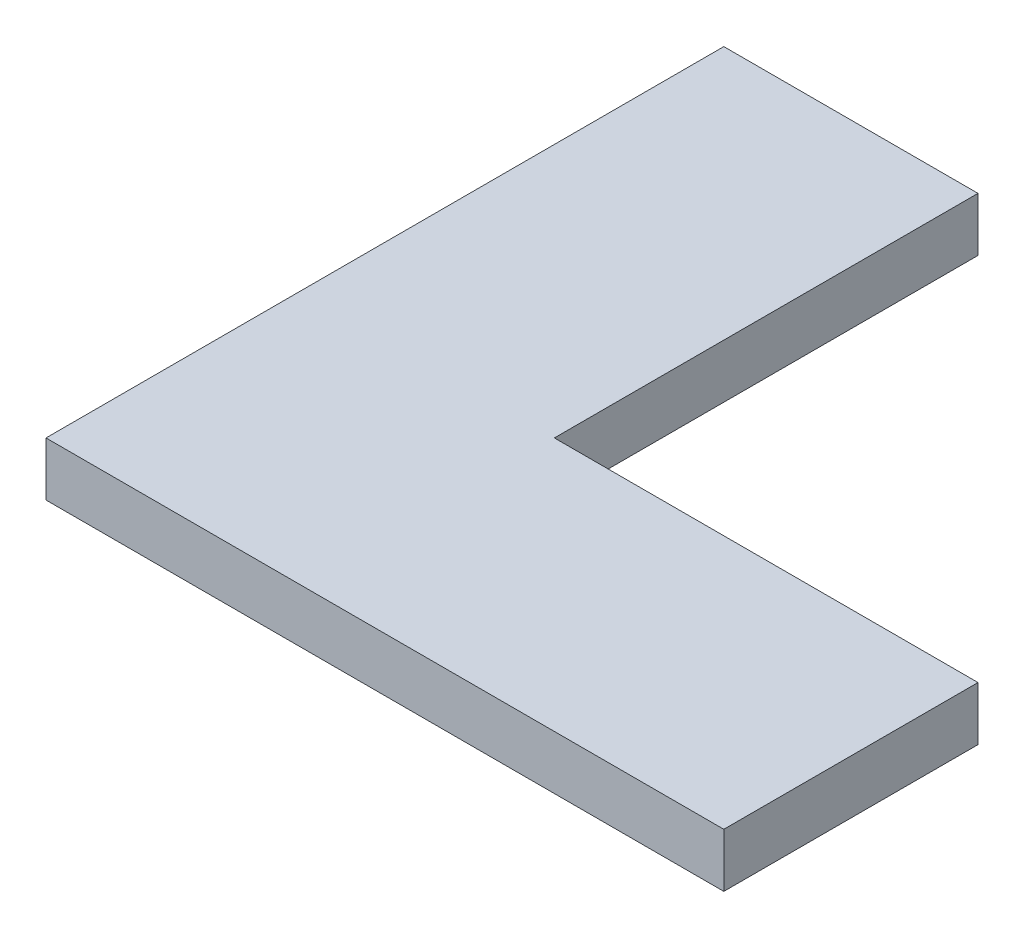
from build123d import *

# Parameters (mm, degrees)
BOSS_EXTRUDE1_DEPTH = 3.175


with BuildPart() as part:
    # Sketch1 → Boss-Extrude1 (new, symmetric)
    with BuildSketch(Plane(origin=(0, 0, 0), x_dir=(1, 0, 0), z_dir=(0, 1, 0))):
        Polygon((-40, 40), (-40, -40), (40, -40), (40, -10), (-10, -10), (-10, 40), align=None)
    extrude(amount=BOSS_EXTRUDE1_DEPTH, both=True)


solid = part.part
